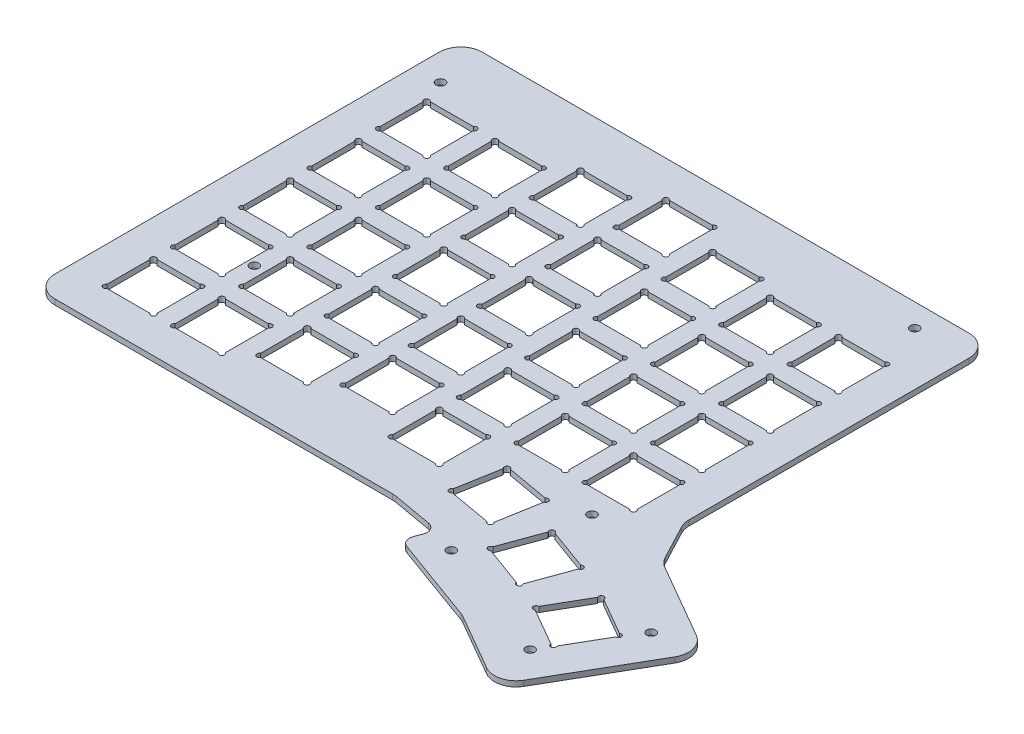
from build123d import *

# Parameters (mm, degrees)
BOSS_EXTRUDE1_DEPTH = 1.5
CUT_EXTRUDE1_DEPTH  = 10
SKETCH3_R           = 0.75
SKETCH3_W           = 14.000106754
SKETCH3_H           = 14.000106754
CUT_EXTRUDE2_DEPTH  = 10
CUT_EXTRUDE3_DEPTH  = 10
CUT_EXTRUDE4_DEPTH  = 10
SKETCH6_R           = 0.75
SKETCH6_W           = 14.000106753
SKETCH6_H           = 14.000106754
CUT_EXTRUDE5_DEPTH  = 10
SKETCH7_R           = 0.75
SKETCH7_W           = 14.000106753
SKETCH7_H           = 14.000106754
CUT_EXTRUDE6_DEPTH  = 10
CUT_EXTRUDE7_DEPTH  = 10
LPATTERN1_COUNT     = 5
LPATTERN1_PITCH     = 19.05
LPATTERN2_COUNT     = 4
LPATTERN2_PITCH     = 19.05
SKETCH10_R          = 0.75
CUT_EXTRUDE8_DEPTH  = 10
SKETCH11_R          = 0.75
CUT_EXTRUDE10_DEPTH = 10
SKETCH12_R          = 0.75
CUT_EXTRUDE11_DEPTH = 10
FILLET5_R           = 6
FILLET6_R           = 2.5
SKETCH50_R          = 1.25
CUT_EXTRUDE18_DEPTH = 10


with BuildPart() as part:
    # Sketch1 → Boss-Extrude1 (new body)
    with BuildSketch(Plane(origin=(0, 0, 0), x_dir=(1, 0, 0), z_dir=(0, 1, 0))):
        Polygon((-118.776202628, 124.649117269), (29.023792964, 124.649117269), (29.023792964, 39.084735524), (35.633258009, 26.526563566), (63.152428214, 10.63836324), (41.746290184, -26.438155422), (20.387402584, -14.106595916), (-6.244093176, -4.413524166), (-3.583815836, 2.895527755), (-18.065941619, 5.449117269), (-118.776202628, 5.449117269), align=None)
    extrude(amount=-BOSS_EXTRUDE1_DEPTH)

    # Sketch2 → Cut-Extrude1 (cut)
    with BuildSketch(Plane(origin=(0, 0, 0), x_dir=(1, 0, 0), z_dir=(0, 1, 0))):
        with BuildLine():
            ThreePointArc((-50.87321141, 114.949117269), (-52.064979323, 115.125893964), (-51.888202628, 113.934126051))
            Line((-51.888202628, 113.934126051), (-51.888202628, 101.854762951))
            ThreePointArc((-51.888202628, 101.854762951), (-52.241756019, 100.595563878), (-50.982556946, 100.949117269))
            Line((-50.982556946, 100.949117269), (-38.903193847, 100.949117269))
            ThreePointArc((-38.903193847, 100.949117269), (-37.711425933, 100.772340574), (-37.888202628, 101.964108487))
            Line((-37.888202628, 101.964108487), (-37.888202628, 113.934126051))
            ThreePointArc((-37.888202628, 113.934126051), (-37.711425933, 115.125893964), (-38.903193847, 114.949117269))
            Line((-38.903193847, 114.949117269), (-50.87321141, 114.949117269))
        make_face()
    cut_extrude1 = extrude(amount=-CUT_EXTRUDE1_DEPTH, mode=Mode.SUBTRACT)

    # Sketch3 → Cut-Extrude2 (cut)
    with BuildSketch(Plane(origin=(0, 0, 0), x_dir=(1, 0, 0), z_dir=(0, 1, 0))):
        with Locations((-57.291702642, 109.833063878)):
            Circle(SKETCH3_R)
        with Locations((-70.584702614, 109.833063878)):
            Circle(SKETCH3_R)
        with Locations((-70.584702614, 96.540063906)):
            Circle(SKETCH3_R)
        with Locations((-57.291702642, 96.540063906)):
            Circle(SKETCH3_R)
        with Locations((-63.938202628, 103.186563892)):
            Rectangle(SKETCH3_W, SKETCH3_H)
    cut_extrude2 = extrude(amount=-CUT_EXTRUDE2_DEPTH, mode=Mode.SUBTRACT)

    # Sketch4 → Cut-Extrude3 (cut)
    with BuildSketch(Plane(origin=(0, 0, 0), x_dir=(1, 0, 0), z_dir=(0, 1, 0))):
        with BuildLine():
            ThreePointArc((-88.973264787, 105.424117269), (-90.1650327, 105.600893964), (-89.988256005, 104.409126051))
            Line((-89.988256005, 104.409126051), (-89.988256005, 92.439001734))
            ThreePointArc((-89.988256005, 92.439001734), (-90.1650327, 91.24723382), (-88.973264787, 91.424010515))
            Line((-88.973264787, 91.424010515), (-77.00314047, 91.424010515))
            ThreePointArc((-77.00314047, 91.424010515), (-75.811372556, 91.24723382), (-75.988149251, 92.439001734))
            Line((-75.988149251, 92.439001734), (-75.988149251, 104.409126051))
            ThreePointArc((-75.988149251, 104.409126051), (-75.811372556, 105.600893964), (-77.00314047, 105.424117269))
            Line((-77.00314047, 105.424117269), (-88.973264787, 105.424117269))
        make_face()
    cut_extrude3 = extrude(amount=-CUT_EXTRUDE3_DEPTH, mode=Mode.SUBTRACT)

    # Sketch5 → Cut-Extrude4 (cut)
    with BuildSketch(Plane(origin=(0, 0, 0), x_dir=(1, 0, 0), z_dir=(0, 1, 0))):
        with BuildLine():
            ThreePointArc((-108.023264787, 105.424117269), (-109.2150327, 105.600893964), (-109.038256005, 104.409126051))
            Line((-109.038256005, 104.409126051), (-109.038256005, 92.439001734))
            ThreePointArc((-109.038256005, 92.439001734), (-109.2150327, 91.24723382), (-108.023264787, 91.424010515))
            Line((-108.023264787, 91.424010515), (-96.05314047, 91.424010515))
            ThreePointArc((-96.05314047, 91.424010515), (-94.861372556, 91.24723382), (-95.038149251, 92.439001734))
            Line((-95.038149251, 92.439001734), (-95.038149251, 104.409126051))
            ThreePointArc((-95.038149251, 104.409126051), (-94.861372556, 105.600893964), (-96.05314047, 105.424117269))
            Line((-96.05314047, 105.424117269), (-108.023264787, 105.424117269))
        make_face()
    cut_extrude4 = extrude(amount=-CUT_EXTRUDE4_DEPTH, mode=Mode.SUBTRACT)

    # Sketch6 → Cut-Extrude5 (cut)
    with BuildSketch(Plane(origin=(0, 0, 0), x_dir=(1, 0, 0), z_dir=(0, 1, 0))):
        with Locations((-32.484649238, 108.595563878)):
            Circle(SKETCH6_R)
        with Locations((-19.191649265, 108.595563878)):
            Circle(SKETCH6_R)
        with Locations((-32.484649238, 95.302563906)):
            Circle(SKETCH6_R)
        with Locations((-19.191649265, 95.302563906)):
            Circle(SKETCH6_R)
        with Locations((-25.838149252, 101.949063892)):
            Rectangle(SKETCH6_W, SKETCH6_H)
    cut_extrude5 = extrude(amount=-CUT_EXTRUDE5_DEPTH, mode=Mode.SUBTRACT)

    # Sketch7 → Cut-Extrude6 (cut)
    with BuildSketch(Plane(origin=(0, 0, 0), x_dir=(1, 0, 0), z_dir=(0, 1, 0))):
        with Locations((-13.434649238, 105.595563878)):
            Circle(SKETCH7_R)
        with Locations((-0.141649265, 105.595563878)):
            Circle(SKETCH7_R)
        with Locations((-0.141649265, 92.302563906)):
            Circle(SKETCH7_R)
        with Locations((-13.434649238, 92.302563906)):
            Circle(SKETCH7_R)
        with Locations((-6.788149252, 98.949063892)):
            Rectangle(SKETCH7_W, SKETCH7_H)
    cut_extrude6 = extrude(amount=-CUT_EXTRUDE6_DEPTH, mode=Mode.SUBTRACT)

    # Sketch8 → Cut-Extrude7 (cut)
    with BuildSketch(Plane(origin=(0, 0, 0), x_dir=(1, 0, 0), z_dir=(0, 1, 0))):
        with BuildLine():
            ThreePointArc((6.27678859, 105.949117269), (5.085020677, 106.125893964), (5.261797372, 104.934126051))
            Line((5.261797372, 104.934126051), (5.261797372, 92.964001734))
            ThreePointArc((5.261797372, 92.964001734), (5.085020677, 91.77223382), (6.27678859, 91.949010515))
            Line((6.27678859, 91.949010515), (18.246912907, 91.949010515))
            ThreePointArc((18.246912907, 91.949010515), (19.438680821, 91.77223382), (19.261904125, 92.964001734))
            Line((19.261904125, 92.964001734), (19.261904125, 104.934126051))
            ThreePointArc((19.261904125, 104.934126051), (19.438680821, 106.125893964), (18.246912907, 105.949117269))
            Line((18.246912907, 105.949117269), (6.27678859, 105.949117269))
        make_face()
    cut_extrude7 = extrude(amount=-CUT_EXTRUDE7_DEPTH, mode=Mode.SUBTRACT)

    # LPattern1: Cut-Extrude1, Cut-Extrude2, Cut-Extrude3, Cut-Extrude4, Cut-Extrude5 ×5
    with Locations(*[(0, 0, i * LPATTERN1_PITCH) for i in range(1, LPATTERN1_COUNT)]):
        add(cut_extrude1, mode=Mode.SUBTRACT)
        add(cut_extrude2, mode=Mode.SUBTRACT)
        add(cut_extrude3, mode=Mode.SUBTRACT)
        add(cut_extrude4, mode=Mode.SUBTRACT)
        add(cut_extrude5, mode=Mode.SUBTRACT)

    # LPattern2: Cut-Extrude6, Cut-Extrude7 ×4
    with Locations(*[(0, 0, i * LPATTERN2_PITCH) for i in range(1, LPATTERN2_COUNT)]):
        add(cut_extrude6, mode=Mode.SUBTRACT)
        add(cut_extrude7, mode=Mode.SUBTRACT)

    # Sketch10 → Cut-Extrude8 (cut)
    with BuildSketch(Plane(origin=(0, 0, 0), x_dir=(1, 0, 0), z_dir=(0, 1, 0))):
        with Locations((-8.803417982, 27.572637843)):
            Circle(SKETCH10_R)
        with Locations((4.287631452, 25.264332622)):
            Circle(SKETCH10_R)
        with Locations((-11.111723203, 14.48158841)):
            Circle(SKETCH10_R)
        with Locations((1.979326231, 12.173283189)):
            Circle(SKETCH10_R)
        Polygon((-9.0902062, 27.982213866), (4.697207474, 25.551120841), (2.266114449, 11.763707167), (-11.521299225, 14.194800192), align=None)
    extrude(amount=-CUT_EXTRUDE8_DEPTH, mode=Mode.SUBTRACT)

    # Sketch11 → Cut-Extrude10 (cut)
    with BuildSketch(Plane(origin=(0, 0, 0), x_dir=(1, 0, 0), z_dir=(0, 1, 0))):
        with Locations((12.864798514, 18.45674911)):
            Circle(SKETCH11_R)
        with Locations((25.356132496, 13.910275354)):
            Circle(SKETCH11_R)
        with Locations((20.80965874, 1.418941372)):
            Circle(SKETCH11_R)
        with Locations((8.318324758, 5.965415128)):
            Circle(SKETCH11_R)
        Polygon((12.653489383, 18.909903004), (25.809286389, 14.121584485), (21.020967871, 0.965787479), (7.865170864, 5.754105997), align=None)
    extrude(amount=-CUT_EXTRUDE10_DEPTH, mode=Mode.SUBTRACT)

    # Sketch12 → Cut-Extrude11 (cut)
    with BuildSketch(Plane(origin=(0, 0, 0), x_dir=(1, 0, 0), z_dir=(0, 1, 0))):
        with Locations((35.607708934, 9.418383919)):
            Circle(SKETCH12_R)
        with Locations((47.119784603, 2.771883933)):
            Circle(SKETCH12_R)
        with Locations((40.473284617, -8.740191736)):
            Circle(SKETCH12_R)
        with Locations((28.961208948, -2.093691749)):
            Circle(SKETCH12_R)
        Polygon((35.478299412, 9.901346832), (47.602747516, 2.901293456), (40.602694139, -9.223154649), (28.478246035, -2.223101272), align=None)
    extrude(amount=-CUT_EXTRUDE11_DEPTH, mode=Mode.SUBTRACT)

    # Fillet5
    fillet5_edges = [part.edges().sort_by_distance(p)[0] for p in [
        (29.023792964, -0.75, -39.084735524),
        (35.633258009, -0.75, -26.526563566),
        (63.152428214, -0.75, -10.63836324),
        (41.746290184, -0.75, 26.438155422),
        (20.387402584, -0.75, 14.106595916),
        (-18.065941619, -0.75, -5.449117269),
        (-118.776202628, -0.75, -5.449117269),
        (-118.776202628, -0.75, -124.649117269),
        (29.023792964, -0.75, -124.649117269),
    ]]
    fillet(fillet5_edges, radius=FILLET5_R)

    # Fillet6
    fillet6_edges = [part.edges().sort_by_distance(p)[0] for p in [
        (-3.583815836, -0.75, -2.895527755),
        (-6.244093176, -0.75, 4.413524166),
    ]]
    fillet(fillet6_edges, radius=FILLET6_R)

    # Sketch50 → Cut-Extrude18 (cut)
    with BuildSketch(Plane(origin=(0, -1.5, 0), x_dir=(-1, 0, 0), z_dir=(0, -1, 0))):
        with Locations((111.276202628, 111.515169269)):
            Circle(SKETCH50_R)
        with Locations((-14.223797372, 118.249117269)):
            Circle(SKETCH50_R)
        with Locations((92.976202628, 41.283065269)):
            Circle(SKETCH50_R)
        with Locations((-14.223797372, 28.249117269)):
            Circle(SKETCH50_R)
        with Locations((-50.989849372, 7.999117269)):
            Circle(SKETCH50_R)
        with Locations((-38.223797372, -13.000882731)):
            Circle(SKETCH50_R)
        with Locations((-3.239849372, -0.000882731)):
            Circle(SKETCH50_R)
    extrude(amount=-CUT_EXTRUDE18_DEPTH, mode=Mode.SUBTRACT)


solid = part.part
